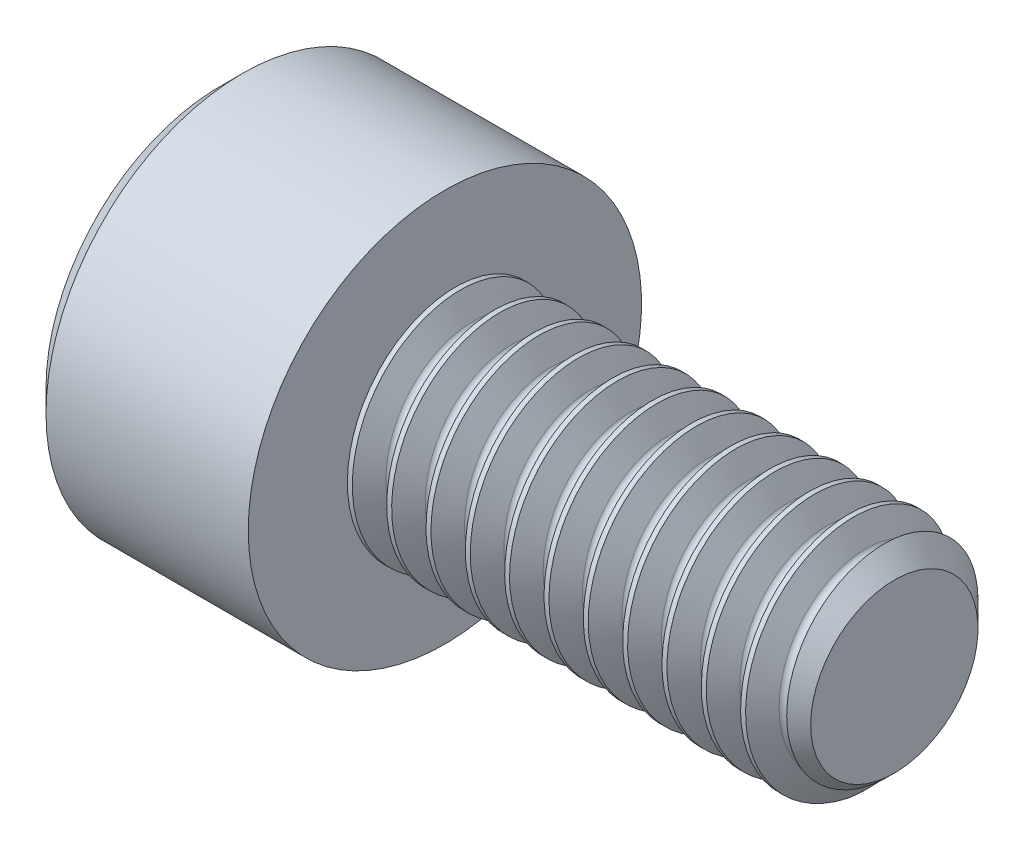
from build123d import *

# Parameters (mm, degrees)
CHAMFER1_SIZE      = 0.5
CHAMFER2_SIZE      = 0.4
CUT_EXTRUDE1_DEPTH = 2
CHAMFER3_SIZE      = 0.3
CUT_SWEEP1_PITCH   = 0.7
CUT_SWEEP1_TO      = 8


with BuildPart() as part:
    # Sketch1 → Revolve1 (revolve)
    with BuildSketch(Plane.XY, mode=Mode.PRIVATE) as revolve1_sk:
        Polygon((0, 0), (0, 3.5), (4, 3.5), (4, 1.989), (12, 1.989), (12, 0), align=None)
    revolve(revolve1_sk.sketch.rotate(Axis((-88.705490849, 0, 0), (1, 0, 0)), 90), axis=Axis((-88.705490849, 0, 0), (1, 0, 0)))

    # Chamfer1
    chamfer1_edges = [part.edges().sort_by_distance(p)[0] for p in [
        (12, 0, -1.989),
    ]]
    chamfer(chamfer1_edges, length=CHAMFER1_SIZE)

    # Chamfer2
    chamfer2_edges = [part.edges().sort_by_distance(p)[0] for p in [
        (0, 0, -3.5),
    ]]
    chamfer(chamfer2_edges, length=CHAMFER2_SIZE)

    # Sketch3 → Cut-Extrude1 (cut)
    with BuildSketch(Plane(origin=(0, 0, 0), x_dir=(0, 0, -1), z_dir=(1, 0, 0))):
        Polygon((-1.732050808, 0), (-0.866025404, -1.5), (0.866025404, -1.5), (1.732050808, 0), (0.866025404, 1.5), (-0.866025404, 1.5), align=None)
    extrude(amount=CUT_EXTRUDE1_DEPTH, mode=Mode.SUBTRACT)

    # Chamfer3
    chamfer3_edges = [part.edges().sort_by_distance(p)[0] for p in [
        (0, 0.75, 1.299038106),
        (0, -0.75, 1.299038106),
        (0, -1.5, 0),
        (0, -0.75, -1.299038106),
        (0, 0.75, -1.299038106),
        (0, 1.5, 0),
    ]]
    chamfer(chamfer3_edges, length=CHAMFER3_SIZE)

    # Cut-Sweep1: arcs per turn and ends read off the stored shape
    # Cut-Sweep1: the profile of Sketch8 screwed along a right-hand helix through 13 turns, 6 arcs to a turn; built about Z, then put on its axis
    cut_sweep1_z = Axis((0, 0, 0), (0, 0, 1))
    cut_sweep1_corners = [(1.61025, 0, -0.087468566), (2.254125, 0, -0.45920997), (2.254125, 0, 0.45920997), (1.61025, 0, 0.087468566), (1.55975, 0, 0)]
    with BuildLine(mode=Mode.PRIVATE) as cut_sweep1_profile:
        Line(cut_sweep1_corners[0], cut_sweep1_corners[1])
        Line(cut_sweep1_corners[1], cut_sweep1_corners[2])
        Line(cut_sweep1_corners[2], cut_sweep1_corners[3])
        ThreePointArc((1.61025, 0, 0.087468566), (1.573281434, 0, 0.0505), (1.55975, 0, 0))
        ThreePointArc((1.55975, 0, 0), (1.573281434, 0, -0.0505), (1.61025, 0, -0.087468566))
    cut_sweep1_cap = Face(cut_sweep1_profile.wire())
    cut_sweep1_arcs = [((1.61025, 0, 0.087468566), (1.55975, 0, 0.058312377), (1.55975, 0, 0), (1, 0.8660254037844314, 1)), ((1.55975, 0, 0), (1.55975, 0, -0.058312377), (1.61025, 0, -0.087468566), (1, 0.8660254037844314, 1))]  # start, shoulder, end, weights
    cut_sweep1_turn_angles = [0, 30, 60, 90, 120, 150, 180, 210, 240, 270, 300, 330, 360]
    cut_sweep1_turn_weights = [1, 0.8660254037844387, 1, 0.8660254037844387, 1, 0.8660254037844387, 1, 0.8660254037844387, 1, 0.8660254037844387, 1, 0.8660254037844387, 1]
    cut_sweep1_turn_rails = [Edge.make_bspline([Vector(p[0], p[1], 0).rotate(cut_sweep1_z, cut_sweep1_turn_angles[k]) / cut_sweep1_turn_weights[k] + Vector(0, 0, p[2] + CUT_SWEEP1_PITCH * cut_sweep1_turn_angles[k] / 360) for k in range(13)], [0, 0, 0, 1, 1, 2, 2, 3, 3, 4, 4, 5, 5, 6, 6, 6], 2, cut_sweep1_turn_weights) for p in cut_sweep1_corners]
    cut_sweep1_turn_sides = [*[Face.make_surface_from_curves(cut_sweep1_turn_rails[p[0]], cut_sweep1_turn_rails[p[1]]) for p in [(0, 1), (1, 2), (2, 3)]], *[Face.make_bezier_surface([[Vector(p[j][0], p[j][1], 0).rotate(cut_sweep1_z, cut_sweep1_turn_angles[2 * i + k]) / cut_sweep1_turn_weights[2 * i + k] + Vector(0, 0, p[j][2] + CUT_SWEEP1_PITCH * cut_sweep1_turn_angles[2 * i + k] / 360) for k in range(3)] for j in range(3)], [[p[3][j] * cut_sweep1_turn_weights[2 * i + k] for k in range(3)] for j in range(3)]) for p in cut_sweep1_arcs for i in range(6)]]
    cut_sweep1_turn = Solid(Shell([*cut_sweep1_turn_sides, cut_sweep1_cap, cut_sweep1_cap.rotate(cut_sweep1_z, 360).moved(Location((0, 0, CUT_SWEEP1_PITCH * 360 / 360)))]))
    cut_sweep1_each = [*[cut_sweep1_turn.moved(Location((0, 0, CUT_SWEEP1_PITCH * i))) for i in range(13)]]
    add(Plane(origin=(12, 0, 0), x_dir=(0, 0, -1), z_dir=(-1, 0, 0)) * split(Compound([cut_sweep1_each[i] for i in range(0, 13, 2)]), bisect_by=Plane.XY.offset(CUT_SWEEP1_TO), keep=Keep.BOTTOM, mode=Mode.PRIVATE), mode=Mode.SUBTRACT)
    add(Plane(origin=(12, 0, 0), x_dir=(0, 0, -1), z_dir=(-1, 0, 0)) * split(Compound([cut_sweep1_each[i] for i in range(1, 13, 2)]), bisect_by=Plane.XY.offset(CUT_SWEEP1_TO), keep=Keep.BOTTOM, mode=Mode.PRIVATE), mode=Mode.SUBTRACT)


solid = part.part
